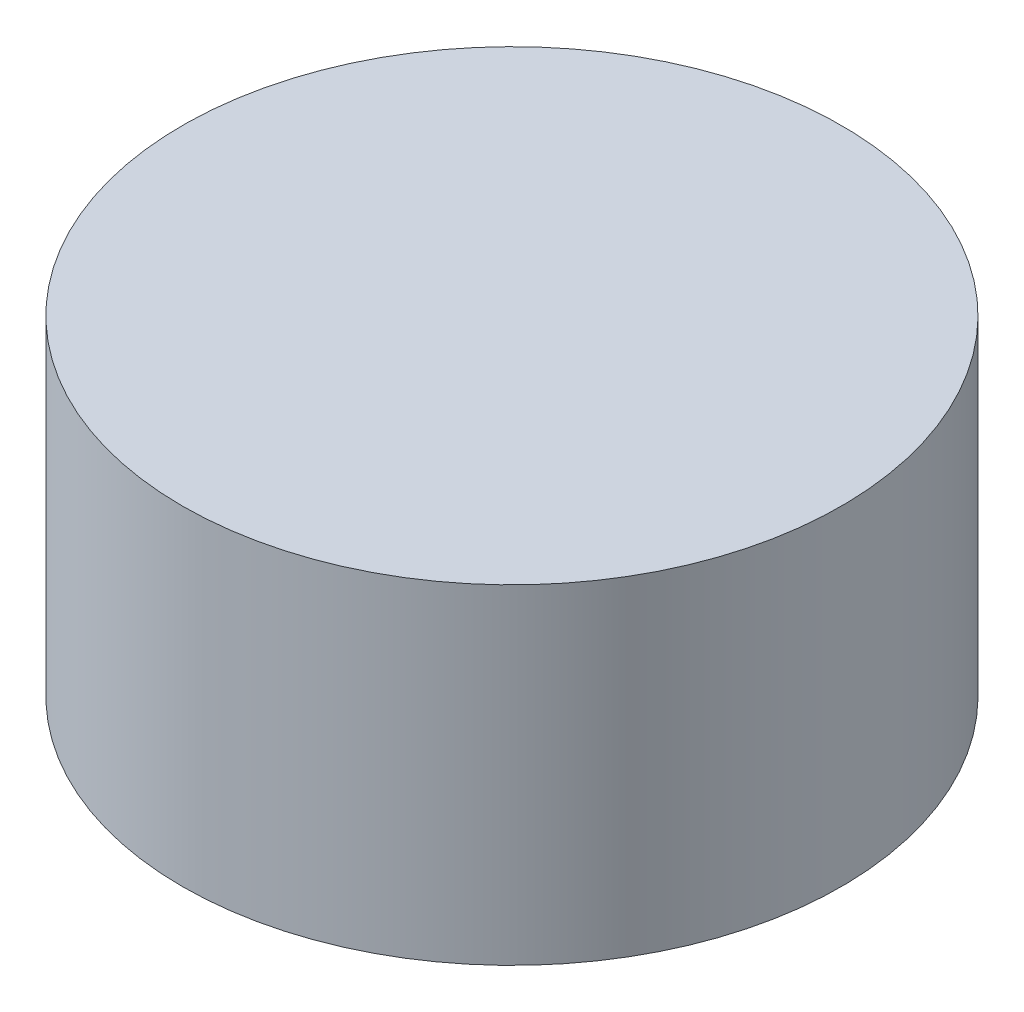
from build123d import *

# Parameters (mm, degrees)
SKETCH1_R           = 12.7
BOSS_EXTRUDE1_DEPTH = 12.7


with BuildPart() as part:
    # Sketch1 → Boss-Extrude1 (new body)
    with BuildSketch(Plane(origin=(0, 0, 0), x_dir=(1, 0, 0), z_dir=(0, 1, 0))):
        Circle(SKETCH1_R)
    extrude(amount=BOSS_EXTRUDE1_DEPTH)


solid = part.part
